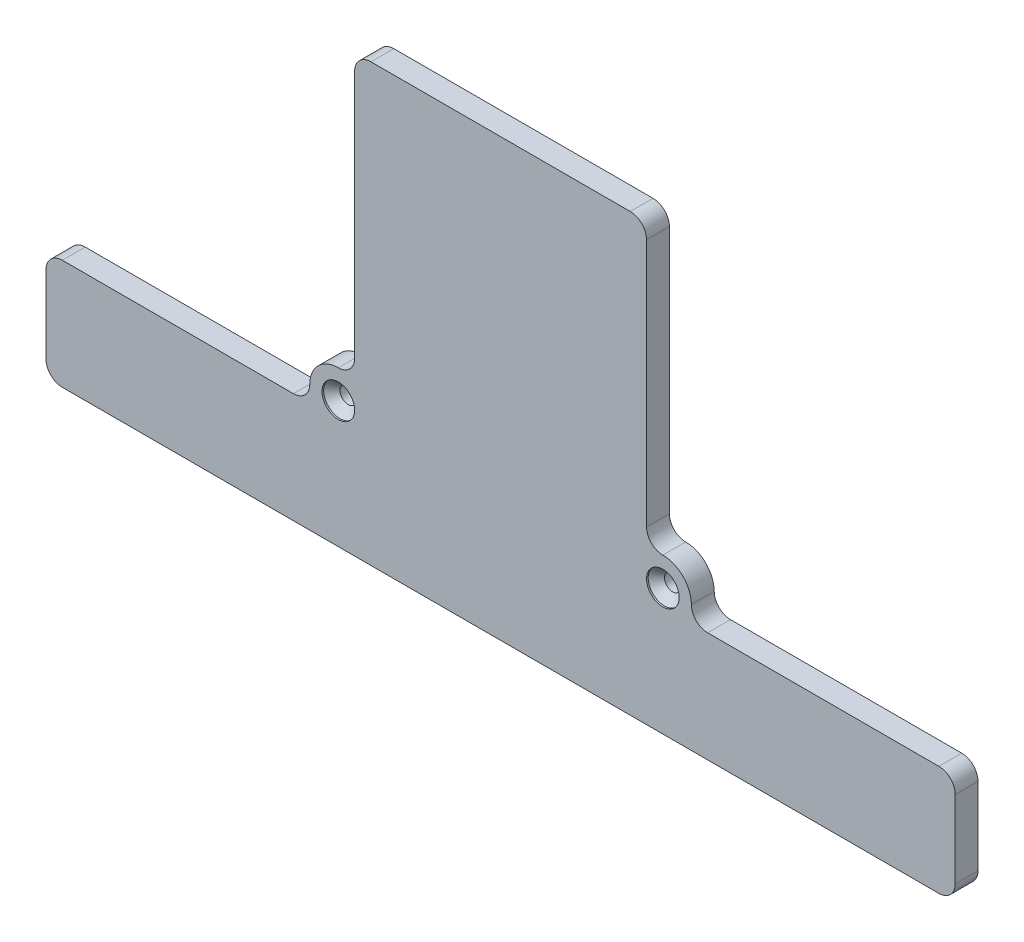
from build123d import *

# Parameters (mm, degrees)
BOSS_EXTRUDE1_DEPTH                            = 2.8
CUT_EXTRUDE1_REACH                             = 63.899
SKETCH3_R                                      = 1
CSK_FOR_M2_FLAT_HEAD_MACHINE_SCREW1_AT_2_COUNT = 2
CSK_FOR_M2_FLAT_HEAD_MACHINE_SCREW1_AT_2_PITCH = 39.8


with BuildPart() as part:
    # Sketch1 → Boss-Extrude1 (new body)
    with BuildSketch(Plane.XY):
        with BuildLine():
            Line((-53.75, -26.75), (53.75, -26.75))
            ThreePointArc((53.75, -26.75), (55.164213562, -26.164213562), (55.75, -24.75))
            Line((55.75, -24.75), (55.75, -15.25))
            ThreePointArc((55.75, -15.25), (55.164213562, -13.835786438), (53.75, -13.25))
            Line((53.75, -13.25), (25.4, -13.25))
            ThreePointArc((25.4, -13.25), (23.985786438, -12.664213562), (23.4, -11.25))
            ThreePointArc((23.4, -11.25), (22.374873734, -8.775126266), (19.9, -7.75))
            ThreePointArc((19.9, -7.75), (18.485786438, -7.164213562), (17.9, -5.75))
            Line((17.9, -5.75), (17.9, 24.75))
            ThreePointArc((17.9, 24.75), (17.314213562, 26.164213562), (15.9, 26.75))
            Line((15.9, 26.75), (-15.9, 26.75))
            ThreePointArc((-15.9, 26.75), (-17.314213562, 26.164213562), (-17.9, 24.75))
            Line((-17.9, 24.75), (-17.9, -5.75))
            ThreePointArc((-17.9, -5.75), (-18.485786438, -7.164213562), (-19.9, -7.75))
            ThreePointArc((-19.9, -7.75), (-22.374873734, -8.775126266), (-23.4, -11.25))
            ThreePointArc((-23.4, -11.25), (-23.985786438, -12.664213562), (-25.4, -13.25))
            Line((-25.4, -13.25), (-53.75, -13.25))
            ThreePointArc((-53.75, -13.25), (-55.164213562, -13.835786438), (-55.75, -15.25))
            Line((-55.75, -15.25), (-55.75, -24.75))
            ThreePointArc((-55.75, -24.75), (-55.164213562, -26.164213562), (-53.75, -26.75))
        make_face()
    extrude(amount=BOSS_EXTRUDE1_DEPTH)

    # Sketch3 → Cut-Extrude1 (cut, up to next)
    with BuildSketch(Plane.XY.offset(2.8), mode=Mode.PRIVATE) as cut_extrude1_sk1:
        with Locations((-19.9, -11.25)):
            Circle(SKETCH3_R)
    cut_extrude1_tool1 = extrude(cut_extrude1_sk1.sketch, amount=-CUT_EXTRUDE1_REACH, mode=Mode.PRIVATE) & part.part
    # Sketch3 → Cut-Extrude1 (cut, up to next)
    with BuildSketch(Plane.XY.offset(2.8), mode=Mode.PRIVATE) as cut_extrude1_sk2:
        with Locations((19.9, -11.25)):
            Circle(SKETCH3_R)
    cut_extrude1_tool2 = extrude(cut_extrude1_sk2.sketch, amount=-CUT_EXTRUDE1_REACH, mode=Mode.PRIVATE) & part.part
    add(cut_extrude1_tool1.solids().sort_by_distance((-19.9, -11.25, 2.8))[0], mode=Mode.SUBTRACT)
    add(cut_extrude1_tool2.solids().sort_by_distance((19.9, -11.25, 2.8))[0], mode=Mode.SUBTRACT)

    # Sketch4 → CSK for M2 Flat Head Machine Screw1 (revolve, cut)
    with BuildSketch(Plane(origin=(-19.9, -11.25, 2.8), x_dir=(0, -1, 0), z_dir=(1, 0, 0))):
        Polygon((0, 0), (0, 2.8), (1, 2.8), (1, 1.2), (2, 0.2), (2, 0), align=None)
    csk_for_m2_flat_head_machine_screw1 = revolve(axis=Axis((-19.9, -11.25, 9.15), (0, 0, -1)), mode=Mode.SUBTRACT)

    # CSK for M2 Flat Head Machine Screw1 at 2: CSK for M2 Flat Head Machine Screw1 ×2
    with Locations(*[(i * CSK_FOR_M2_FLAT_HEAD_MACHINE_SCREW1_AT_2_PITCH, 0, 0) for i in range(1, CSK_FOR_M2_FLAT_HEAD_MACHINE_SCREW1_AT_2_COUNT)]):
        add(csk_for_m2_flat_head_machine_screw1, mode=Mode.SUBTRACT)


solid = part.part
